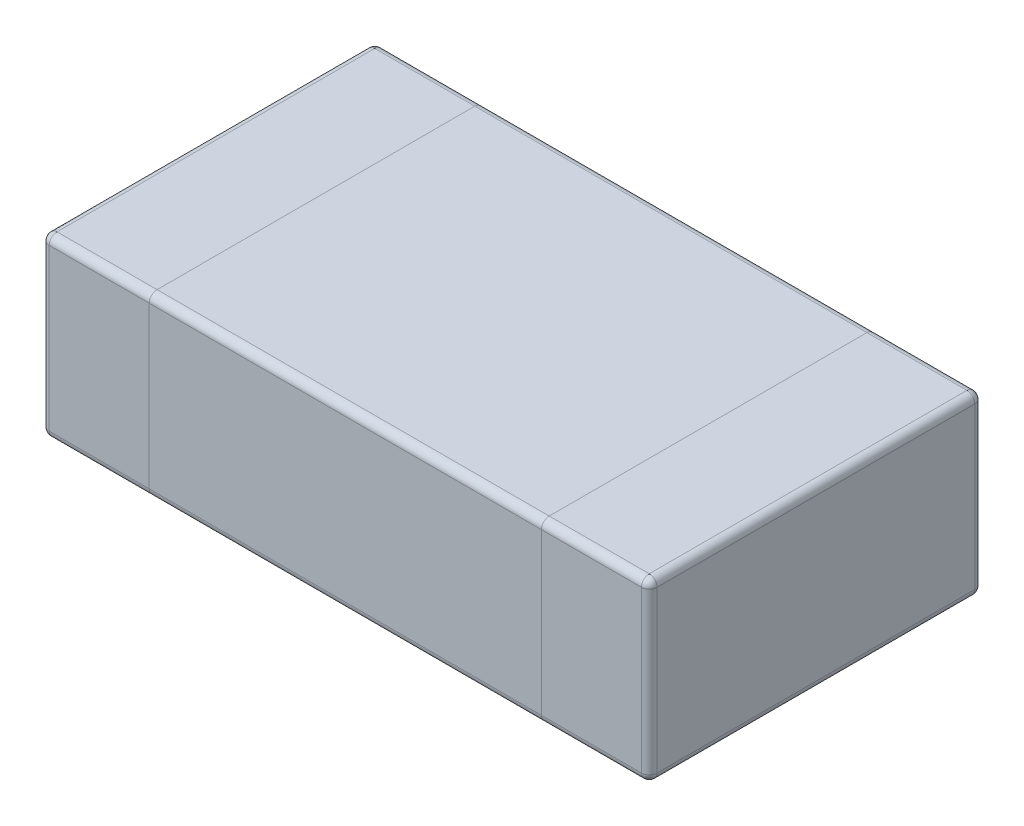
from build123d import *

# Parameters (mm, degrees)
BOSS_EXTRUDE1_DEPTH = 0.225
FILLET2_R           = 0.02


with BuildPart() as part:
    # Sketch1 → Boss-Extrude1 (new, symmetric)
    with BuildSketch(Plane(origin=(0, 0, 0), x_dir=(1, 0, 0), z_dir=(0, 1, 0))):
        with BuildLine():
            Line((-0.755, -0.425), (0.755, -0.425))
            ThreePointArc((0.755, -0.425), (0.769142136, -0.419142136), (0.775, -0.405))
            Line((0.775, -0.405), (0.775, 0.405))
            ThreePointArc((0.775, 0.405), (0.769142136, 0.419142136), (0.755, 0.425))
            Line((0.755, 0.425), (-0.755, 0.425))
            ThreePointArc((-0.755, 0.425), (-0.769142136, 0.419142136), (-0.775, 0.405))
            Line((-0.775, 0.405), (-0.775, -0.405))
            ThreePointArc((-0.775, -0.405), (-0.769142136, -0.419142136), (-0.755, -0.425))
        make_face()
    extrude(amount=BOSS_EXTRUDE1_DEPTH, both=True)

    # Fillet2
    fillet2_edges = [part.edges().sort_by_distance(p)[0] for p in [
        (0, -0.225, 0.425),
        (0, -0.225, 0.425),
        (0, -0.225, 0.425),
        (-0.769142136, -0.225, 0.419142136),
        (-0.775, -0.225, 0),
        (-0.769142136, -0.225, -0.419142136),
        (0, -0.225, -0.425),
        (0, -0.225, -0.425),
        (0, -0.225, -0.425),
        (0.769142136, -0.225, -0.419142136),
        (0.775, -0.225, 0),
        (0.769142136, -0.225, 0.419142136),
        (0, 0.225, -0.425),
        (0, 0.225, -0.425),
        (0, 0.225, -0.425),
        (0.769142136, 0.225, -0.419142136),
        (0.775, 0.225, 0),
        (0.769142136, 0.225, 0.419142136),
        (0, 0.225, 0.425),
        (0, 0.225, 0.425),
        (0, 0.225, 0.425),
        (-0.769142136, 0.225, 0.419142136),
        (-0.775, 0.225, 0),
        (-0.769142136, 0.225, -0.419142136),
    ]]
    fillet(fillet2_edges, radius=FILLET2_R)


solid = part.part
